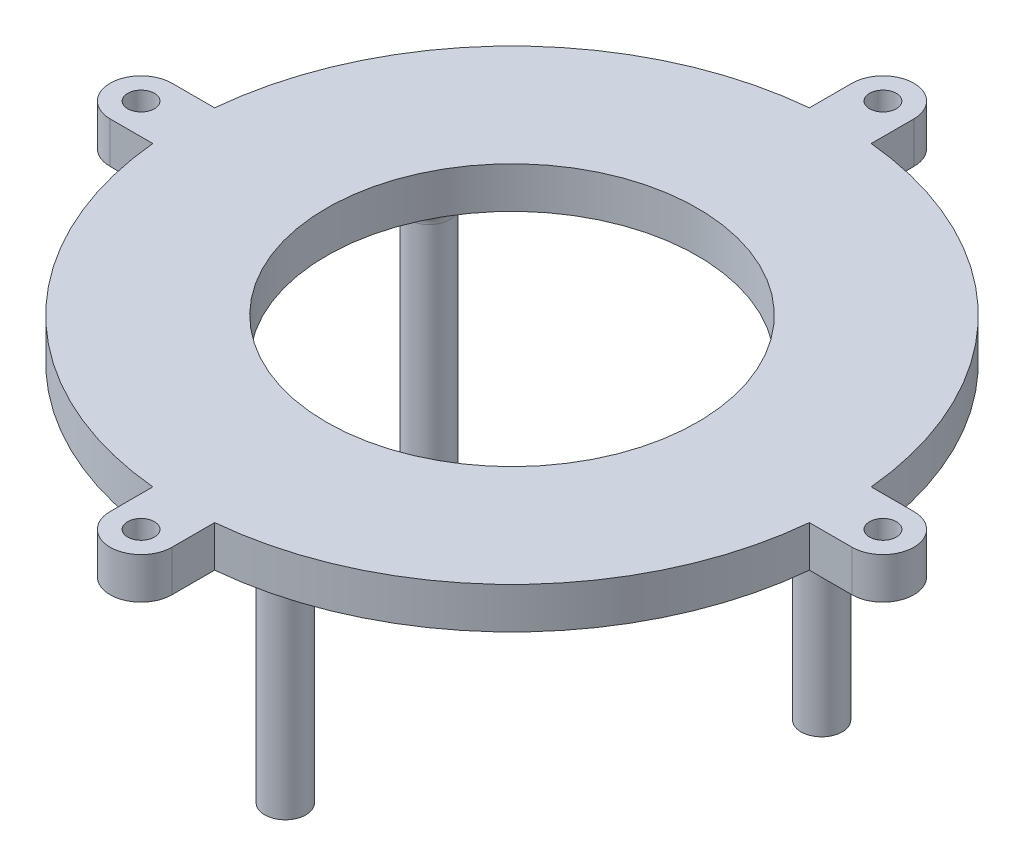
from build123d import *

# Parameters (mm, degrees)
SKETCH1_R           = 1
BOSS_EXTRUDE1_DEPTH = 13
SKETCH2_R           = 9
SKETCH2_R_2         = 0.65
BOSS_EXTRUDE2_DEPTH = 2
CIRPATTERN2_COUNT   = 3
FILLET1_R           = 1


with BuildPart() as part:
    # Sketch1 → Boss-Extrude1 (new body)
    with BuildSketch(Plane(origin=(0, 0, 0), x_dir=(1, 0, 0), z_dir=(0, 1, 0))):
        with Locations(Location((0, -11, 0), (0, 0, 270))):
            Circle(SKETCH1_R)
    boss_extrude1 = extrude(amount=-BOSS_EXTRUDE1_DEPTH)

    # Sketch2 → Boss-Extrude2 (add)
    with BuildSketch(Plane(origin=(0, 0, 0), x_dir=(1, 0, 0), z_dir=(0, 1, 0))):
        with BuildLine():
            Line((-18, 1.5), (-15.929532322, 1.5))
            ThreePointArc((-15.929532322, 1.5), (-11.313708499, 11.313708499), (-1.5, 15.929532322))
            Line((-1.5, 15.929532322), (-1.5, 18))
            ThreePointArc((-1.5, 18), (0, 19.5), (1.5, 18))
            Line((1.5, 18), (1.5, 15.929532322))
            ThreePointArc((1.5, 15.929532322), (11.313708499, 11.313708499), (15.929532322, 1.5))
            Line((15.929532322, 1.5), (18, 1.5))
            ThreePointArc((18, 1.5), (19.5, 0), (18, -1.5))
            Line((18, -1.5), (15.929532322, -1.5))
            ThreePointArc((15.929532322, -1.5), (11.313708499, -11.313708499), (1.5, -15.929532322))
            Line((1.5, -15.929532322), (1.5, -18))
            ThreePointArc((1.5, -18), (0, -19.5), (-1.5, -18))
            Line((-1.5, -18), (-1.5, -15.929532322))
            ThreePointArc((-1.5, -15.929532322), (-11.313708499, -11.313708499), (-15.929532322, -1.5))
            Line((-15.929532322, -1.5), (-18, -1.5))
            ThreePointArc((-18, -1.5), (-19.5, 0), (-18, 1.5))
        make_face()
        with Locations(Location((0, 0, 0), (0, 0, 270))):
            Circle(SKETCH2_R, mode=Mode.SUBTRACT)
        with Locations(Location((0, 18, 0), (0, 0, 270))):
            Circle(SKETCH2_R_2, mode=Mode.SUBTRACT)
        with Locations(Location((18, 0, 0), (0, 0, 270))):
            Circle(SKETCH2_R_2, mode=Mode.SUBTRACT)
        with Locations(Location((-18, 0, 0), (0, 0, 270))):
            Circle(SKETCH2_R_2, mode=Mode.SUBTRACT)
        with Locations(Location((0, -18, 0), (0, 0, 270))):
            Circle(SKETCH2_R_2, mode=Mode.SUBTRACT)
    extrude(amount=BOSS_EXTRUDE2_DEPTH)

    # CirPattern2: Boss-Extrude1 ×3 about axis
    cirpattern2_axis = Axis((0, 0, 0), (0, 1, 0))
    for i in range(1, CIRPATTERN2_COUNT):
        add(boss_extrude1.rotate(cirpattern2_axis, i * 360 / CIRPATTERN2_COUNT))

    # Fillet1
    fillet1_edges = [part.edges().sort_by_distance(p)[0] for p in [
        (0, 0, 10),
        (8.660254038, 0, -5),
        (-8.660254038, 0, -5),
    ]]
    fillet(fillet1_edges, radius=FILLET1_R - 0.0001)  # a hair under: the kernel refuses the full size


solid = part.part
